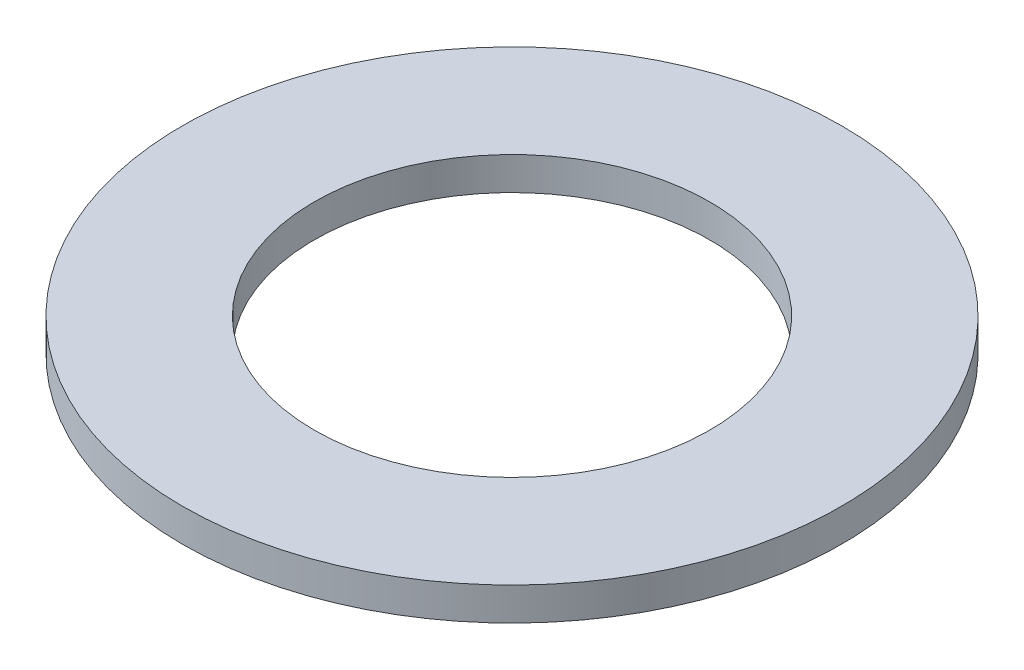
from build123d import *

# Parameters (mm, degrees)
SKETCH1_R           = 10
SKETCH1_R_2         = 6.0005
BOSS_EXTRUDE1_DEPTH = 1


with BuildPart() as part:
    # Sketch1 → Boss-Extrude1 (new body)
    with BuildSketch(Plane(origin=(0, 0, 0), x_dir=(1, 0, 0), z_dir=(0, 1, 0))):
        Circle(SKETCH1_R)
        Circle(SKETCH1_R_2, mode=Mode.SUBTRACT)
    extrude(amount=BOSS_EXTRUDE1_DEPTH)


solid = part.part
